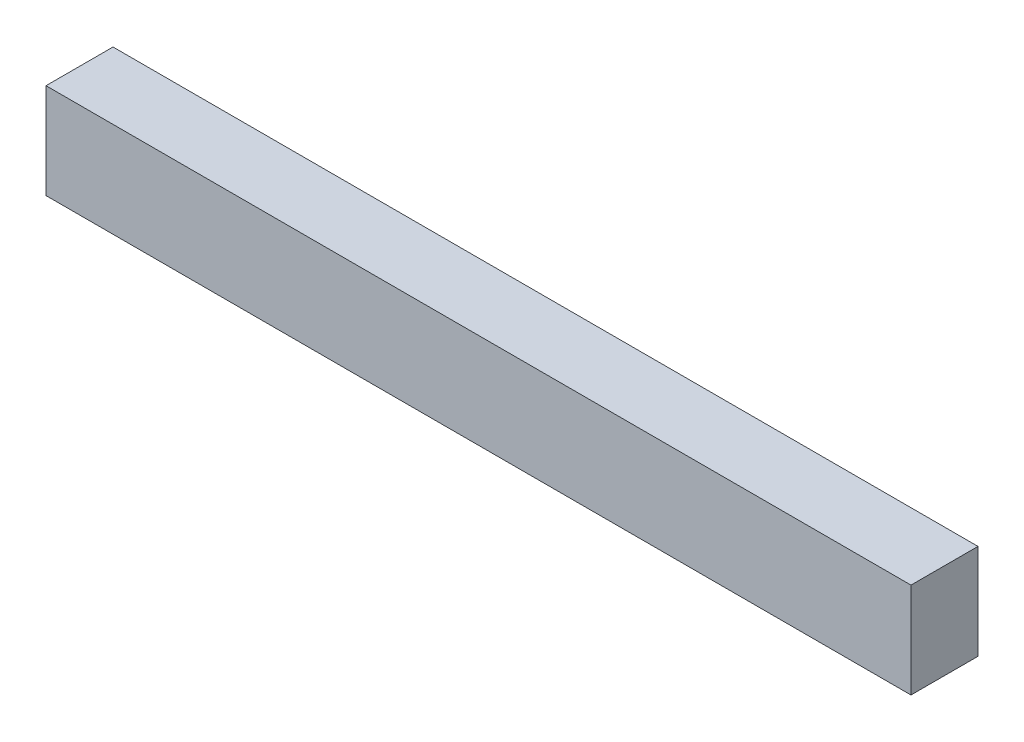
from build123d import *

# Parameters (mm, degrees)
SKETCH1_W           = 90.86
SKETCH1_H           = 7.04
SKETCH1_W_2         = 1.5
SKETCH1_H_2         = 1.5
BOSS_EXTRUDE1_DEPTH = 8
SKETCH2_W           = 90.86
SKETCH2_H           = 7.04
BOSS_EXTRUDE2_DEPTH = 2


with BuildPart() as part:
    # Sketch1 → Boss-Extrude1 (new body)
    with BuildSketch(Plane(origin=(0, 0, 0), x_dir=(1, 0, 0), z_dir=(0, 1, 0))):
        with Locations((45.43, 3.52)):
            Rectangle(SKETCH1_W, SKETCH1_H)
        with Locations((4.79, 2.25)):
            Rectangle(SKETCH1_W_2, SKETCH1_H_2, mode=Mode.SUBTRACT)
        with Locations((2.25, 2.25)):
            Rectangle(SKETCH1_W_2, SKETCH1_H_2, mode=Mode.SUBTRACT)
        with Locations((7.33, 2.25)):
            Rectangle(SKETCH1_W_2, SKETCH1_H_2, mode=Mode.SUBTRACT)
        with Locations((9.87, 2.25)):
            Rectangle(SKETCH1_W_2, SKETCH1_H_2, mode=Mode.SUBTRACT)
        with Locations((12.41, 2.25)):
            Rectangle(SKETCH1_W_2, SKETCH1_H_2, mode=Mode.SUBTRACT)
        with Locations((14.95, 2.25)):
            Rectangle(SKETCH1_W_2, SKETCH1_H_2, mode=Mode.SUBTRACT)
        with Locations((17.49, 2.25)):
            Rectangle(SKETCH1_W_2, SKETCH1_H_2, mode=Mode.SUBTRACT)
        with Locations((20.03, 2.25)):
            Rectangle(SKETCH1_W_2, SKETCH1_H_2, mode=Mode.SUBTRACT)
        with Locations((22.57, 2.25)):
            Rectangle(SKETCH1_W_2, SKETCH1_H_2, mode=Mode.SUBTRACT)
        with Locations((25.11, 2.25)):
            Rectangle(SKETCH1_W_2, SKETCH1_H_2, mode=Mode.SUBTRACT)
        with Locations((27.65, 2.25)):
            Rectangle(SKETCH1_W_2, SKETCH1_H_2, mode=Mode.SUBTRACT)
        with Locations((30.19, 2.25)):
            Rectangle(SKETCH1_W_2, SKETCH1_H_2, mode=Mode.SUBTRACT)
        with Locations((32.73, 2.25)):
            Rectangle(SKETCH1_W_2, SKETCH1_H_2, mode=Mode.SUBTRACT)
        with Locations((35.27, 2.25)):
            Rectangle(SKETCH1_W_2, SKETCH1_H_2, mode=Mode.SUBTRACT)
        with Locations((37.81, 2.25)):
            Rectangle(SKETCH1_W_2, SKETCH1_H_2, mode=Mode.SUBTRACT)
        with Locations((40.35, 2.25)):
            Rectangle(SKETCH1_W_2, SKETCH1_H_2, mode=Mode.SUBTRACT)
        with Locations((42.89, 2.25)):
            Rectangle(SKETCH1_W_2, SKETCH1_H_2, mode=Mode.SUBTRACT)
        with Locations((45.43, 2.25)):
            Rectangle(SKETCH1_W_2, SKETCH1_H_2, mode=Mode.SUBTRACT)
        with Locations((47.97, 2.25)):
            Rectangle(SKETCH1_W_2, SKETCH1_H_2, mode=Mode.SUBTRACT)
        with Locations((50.51, 2.25)):
            Rectangle(SKETCH1_W_2, SKETCH1_H_2, mode=Mode.SUBTRACT)
        with Locations((53.05, 2.25)):
            Rectangle(SKETCH1_W_2, SKETCH1_H_2, mode=Mode.SUBTRACT)
        with Locations((55.59, 2.25)):
            Rectangle(SKETCH1_W_2, SKETCH1_H_2, mode=Mode.SUBTRACT)
        with Locations((58.13, 2.25)):
            Rectangle(SKETCH1_W_2, SKETCH1_H_2, mode=Mode.SUBTRACT)
        with Locations((60.67, 2.25)):
            Rectangle(SKETCH1_W_2, SKETCH1_H_2, mode=Mode.SUBTRACT)
        with Locations((63.21, 2.25)):
            Rectangle(SKETCH1_W_2, SKETCH1_H_2, mode=Mode.SUBTRACT)
        with Locations((65.75, 2.25)):
            Rectangle(SKETCH1_W_2, SKETCH1_H_2, mode=Mode.SUBTRACT)
        with Locations((68.29, 2.25)):
            Rectangle(SKETCH1_W_2, SKETCH1_H_2, mode=Mode.SUBTRACT)
        with Locations((70.83, 2.25)):
            Rectangle(SKETCH1_W_2, SKETCH1_H_2, mode=Mode.SUBTRACT)
        with Locations((73.37, 2.25)):
            Rectangle(SKETCH1_W_2, SKETCH1_H_2, mode=Mode.SUBTRACT)
        with Locations((75.91, 2.25)):
            Rectangle(SKETCH1_W_2, SKETCH1_H_2, mode=Mode.SUBTRACT)
        with Locations((78.45, 2.25)):
            Rectangle(SKETCH1_W_2, SKETCH1_H_2, mode=Mode.SUBTRACT)
        with Locations((80.99, 2.25)):
            Rectangle(SKETCH1_W_2, SKETCH1_H_2, mode=Mode.SUBTRACT)
        with Locations((83.53, 2.25)):
            Rectangle(SKETCH1_W_2, SKETCH1_H_2, mode=Mode.SUBTRACT)
        with Locations((86.07, 2.25)):
            Rectangle(SKETCH1_W_2, SKETCH1_H_2, mode=Mode.SUBTRACT)
        with Locations((88.61, 2.25)):
            Rectangle(SKETCH1_W_2, SKETCH1_H_2, mode=Mode.SUBTRACT)
        with Locations((4.79, 4.79)):
            Rectangle(SKETCH1_W_2, SKETCH1_H_2, mode=Mode.SUBTRACT)
        with Locations((7.33, 4.79)):
            Rectangle(SKETCH1_W_2, SKETCH1_H_2, mode=Mode.SUBTRACT)
        with Locations((9.87, 4.79)):
            Rectangle(SKETCH1_W_2, SKETCH1_H_2, mode=Mode.SUBTRACT)
        with Locations((12.41, 4.79)):
            Rectangle(SKETCH1_W_2, SKETCH1_H_2, mode=Mode.SUBTRACT)
        with Locations((14.95, 4.79)):
            Rectangle(SKETCH1_W_2, SKETCH1_H_2, mode=Mode.SUBTRACT)
        with Locations((17.49, 4.79)):
            Rectangle(SKETCH1_W_2, SKETCH1_H_2, mode=Mode.SUBTRACT)
        with Locations((20.03, 4.79)):
            Rectangle(SKETCH1_W_2, SKETCH1_H_2, mode=Mode.SUBTRACT)
        with Locations((22.57, 4.79)):
            Rectangle(SKETCH1_W_2, SKETCH1_H_2, mode=Mode.SUBTRACT)
        with Locations((25.11, 4.79)):
            Rectangle(SKETCH1_W_2, SKETCH1_H_2, mode=Mode.SUBTRACT)
        with Locations((27.65, 4.79)):
            Rectangle(SKETCH1_W_2, SKETCH1_H_2, mode=Mode.SUBTRACT)
        with Locations((30.19, 4.79)):
            Rectangle(SKETCH1_W_2, SKETCH1_H_2, mode=Mode.SUBTRACT)
        with Locations((32.73, 4.79)):
            Rectangle(SKETCH1_W_2, SKETCH1_H_2, mode=Mode.SUBTRACT)
        with Locations((35.27, 4.79)):
            Rectangle(SKETCH1_W_2, SKETCH1_H_2, mode=Mode.SUBTRACT)
        with Locations((37.81, 4.79)):
            Rectangle(SKETCH1_W_2, SKETCH1_H_2, mode=Mode.SUBTRACT)
        with Locations((40.35, 4.79)):
            Rectangle(SKETCH1_W_2, SKETCH1_H_2, mode=Mode.SUBTRACT)
        with Locations((42.89, 4.79)):
            Rectangle(SKETCH1_W_2, SKETCH1_H_2, mode=Mode.SUBTRACT)
        with Locations((45.43, 4.79)):
            Rectangle(SKETCH1_W_2, SKETCH1_H_2, mode=Mode.SUBTRACT)
        with Locations((47.97, 4.79)):
            Rectangle(SKETCH1_W_2, SKETCH1_H_2, mode=Mode.SUBTRACT)
        with Locations((50.51, 4.79)):
            Rectangle(SKETCH1_W_2, SKETCH1_H_2, mode=Mode.SUBTRACT)
        with Locations((53.05, 4.79)):
            Rectangle(SKETCH1_W_2, SKETCH1_H_2, mode=Mode.SUBTRACT)
        with Locations((55.59, 4.79)):
            Rectangle(SKETCH1_W_2, SKETCH1_H_2, mode=Mode.SUBTRACT)
        with Locations((58.13, 4.79)):
            Rectangle(SKETCH1_W_2, SKETCH1_H_2, mode=Mode.SUBTRACT)
        with Locations((60.67, 4.79)):
            Rectangle(SKETCH1_W_2, SKETCH1_H_2, mode=Mode.SUBTRACT)
        with Locations((63.21, 4.79)):
            Rectangle(SKETCH1_W_2, SKETCH1_H_2, mode=Mode.SUBTRACT)
        with Locations((65.75, 4.79)):
            Rectangle(SKETCH1_W_2, SKETCH1_H_2, mode=Mode.SUBTRACT)
        with Locations((68.29, 4.79)):
            Rectangle(SKETCH1_W_2, SKETCH1_H_2, mode=Mode.SUBTRACT)
        with Locations((70.83, 4.79)):
            Rectangle(SKETCH1_W_2, SKETCH1_H_2, mode=Mode.SUBTRACT)
        with Locations((73.37, 4.79)):
            Rectangle(SKETCH1_W_2, SKETCH1_H_2, mode=Mode.SUBTRACT)
        with Locations((75.91, 4.79)):
            Rectangle(SKETCH1_W_2, SKETCH1_H_2, mode=Mode.SUBTRACT)
        with Locations((78.45, 4.79)):
            Rectangle(SKETCH1_W_2, SKETCH1_H_2, mode=Mode.SUBTRACT)
        with Locations((80.99, 4.79)):
            Rectangle(SKETCH1_W_2, SKETCH1_H_2, mode=Mode.SUBTRACT)
        with Locations((83.53, 4.79)):
            Rectangle(SKETCH1_W_2, SKETCH1_H_2, mode=Mode.SUBTRACT)
        with Locations((86.07, 4.79)):
            Rectangle(SKETCH1_W_2, SKETCH1_H_2, mode=Mode.SUBTRACT)
        with Locations((88.61, 4.79)):
            Rectangle(SKETCH1_W_2, SKETCH1_H_2, mode=Mode.SUBTRACT)
        with Locations((2.25, 4.79)):
            Rectangle(SKETCH1_W_2, SKETCH1_H_2, mode=Mode.SUBTRACT)
    extrude(amount=BOSS_EXTRUDE1_DEPTH)

    # Sketch2 → Boss-Extrude2 (add)
    with BuildSketch(Plane(origin=(0, 8, 0), x_dir=(1, 0, 0), z_dir=(0, 1, 0))):
        with Locations((45.43, 3.52)):
            Rectangle(SKETCH2_W, SKETCH2_H)
    extrude(amount=BOSS_EXTRUDE2_DEPTH)


solid = part.part
